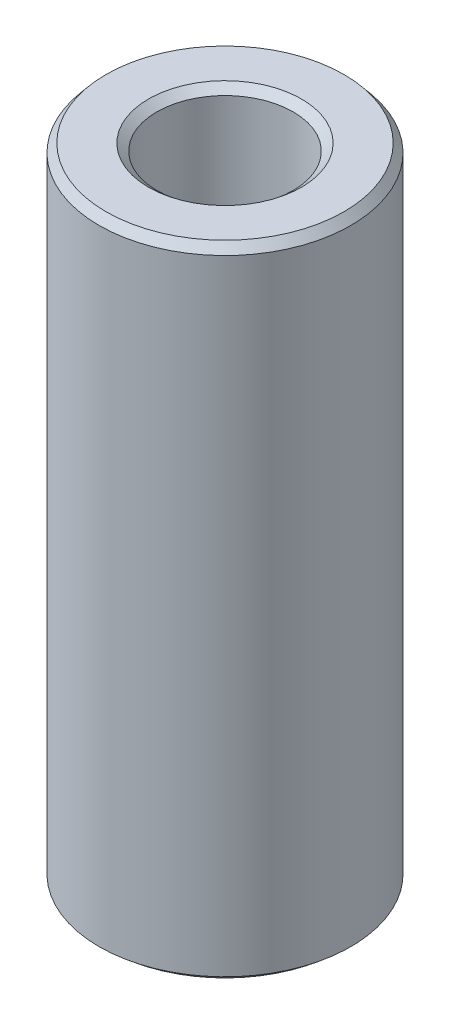
from build123d import *
from OCP.BRepFilletAPI import BRepFilletAPI_MakeChamfer

# Parameters (mm, degrees)
SKETCH1_R           = 50
BOSS_EXTRUDE1_DEPTH = 254.135357599
SKETCH2_R           = 27.057401957
CUT_EXTRUDE1_DEPTH  = 264.789271924
CHAMFER1_SIZE       = 3.32250432
CHAMFER1_SIZE2      = 2.763298706


with BuildPart() as part:
    # Sketch1 → Boss-Extrude1 (new body)
    with BuildSketch(Plane(origin=(0, 0, 0), x_dir=(1, 0, 0), z_dir=(0, 1, 0))):
        Circle(SKETCH1_R)
    extrude(amount=BOSS_EXTRUDE1_DEPTH)

    # Sketch2 → Cut-Extrude1 (cut, through all)
    with BuildSketch(Plane(origin=(0, 0, 0), x_dir=(1, 0, 0), z_dir=(0, 1, 0))):
        Circle(SKETCH2_R)
    extrude(amount=CUT_EXTRUDE1_DEPTH, mode=Mode.SUBTRACT)

    # Chamfer1: one chamfer whose edges measure the first distance from different faces: ONE call of the kernel's chamfer builder (chamfer() names one face for all edges)
    chamfer1_edges_1 = [part.edges().sort_by_distance(p)[0] for p in [
        (-27.057401957, 254.135357599, 0),
    ]]
    chamfer1_side_1 = [part.faces().sort_by_distance(p)[0] for p in [
        (-48.585786438, 254.135357599, 0),
    ]]
    chamfer1_edges_2 = [part.edges().sort_by_distance(p)[0] for p in [
        (-27.057401957, 0, 0),
    ]]
    chamfer1_side_2 = [part.faces().sort_by_distance(p)[0] for p in [
        (-27.057401957, 127.0676788, 0),
    ]]
    chamfer1_edges_3 = [part.edges().sort_by_distance(p)[0] for p in [
        (-50, 0, 0),
    ]]
    chamfer1_side_3 = [part.faces().sort_by_distance(p)[0] for p in [
        (-48.585786438, 0, 0),
    ]]
    chamfer1_edges_4 = [part.edges().sort_by_distance(p)[0] for p in [
        (-50, 254.135357599, 0),
    ]]
    chamfer1_side_4 = [part.faces().sort_by_distance(p)[0] for p in [
        (-50, 127.0676788, 0),
    ]]
    chamfer1 = BRepFilletAPI_MakeChamfer(part.part.solid().wrapped)
    for e in chamfer1_edges_1:
        chamfer1.Add(CHAMFER1_SIZE, CHAMFER1_SIZE2, e.wrapped, chamfer1_side_1[0].wrapped)  # the first distance lies on this face
    for e in chamfer1_edges_2:
        chamfer1.Add(CHAMFER1_SIZE, CHAMFER1_SIZE2, e.wrapped, chamfer1_side_2[0].wrapped)  # the first distance lies on this face
    for e in chamfer1_edges_3:
        chamfer1.Add(CHAMFER1_SIZE, CHAMFER1_SIZE2, e.wrapped, chamfer1_side_3[0].wrapped)  # the first distance lies on this face
    for e in chamfer1_edges_4:
        chamfer1.Add(CHAMFER1_SIZE, CHAMFER1_SIZE2, e.wrapped, chamfer1_side_4[0].wrapped)  # the first distance lies on this face
    add(Compound.cast(chamfer1.Shape()), mode=Mode.REPLACE)


solid = part.part
